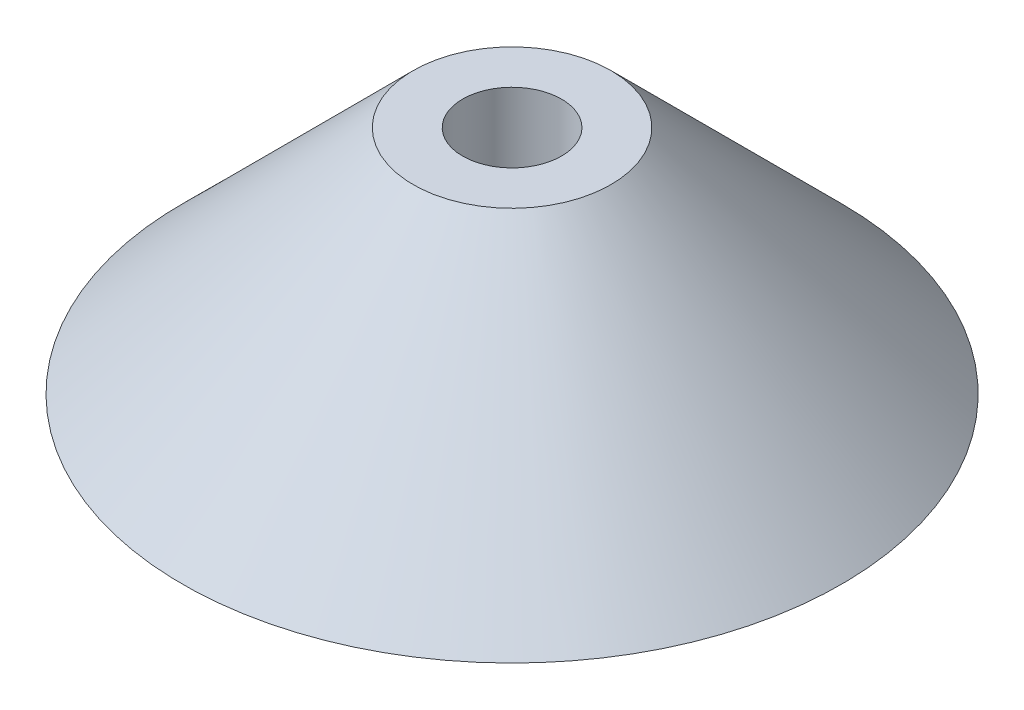
from build123d import *

# Parameters (mm, degrees)
SKETCH1_R           = 10
BOSS_EXTRUDE1_DEPTH = 7
CHAMFER1_SIZE       = 7
SKETCH2_R           = 1.5
CUT_EXTRUDE1_DEPTH  = 16.779733838


with BuildPart() as part:
    # Sketch1 → Boss-Extrude1 (new body)
    with BuildSketch(Plane(origin=(0, 0, 0), x_dir=(1, 0, 0), z_dir=(0, 1, 0))):
        with Locations(Location((0, 0, 0), (0, 0, 270))):
            Circle(SKETCH1_R)
    extrude(amount=BOSS_EXTRUDE1_DEPTH)

    # Chamfer1
    chamfer1_edges = [part.edges().sort_by_distance(p)[0] for p in [
        (0, 7, -10),
    ]]
    chamfer(chamfer1_edges, length=CHAMFER1_SIZE - 0.0001)  # a hair under: the kernel refuses the full size

    # Sketch2 → Cut-Extrude1 (cut, through all)
    with BuildSketch(Plane(origin=(0, 7, 0), x_dir=(1, 0, 0), z_dir=(0, 1, 0))):
        with Locations(Location((0, 0, 0), (0, 0, 270))):
            Circle(SKETCH2_R)
    extrude(amount=-CUT_EXTRUDE1_DEPTH, mode=Mode.SUBTRACT)


solid = part.part
